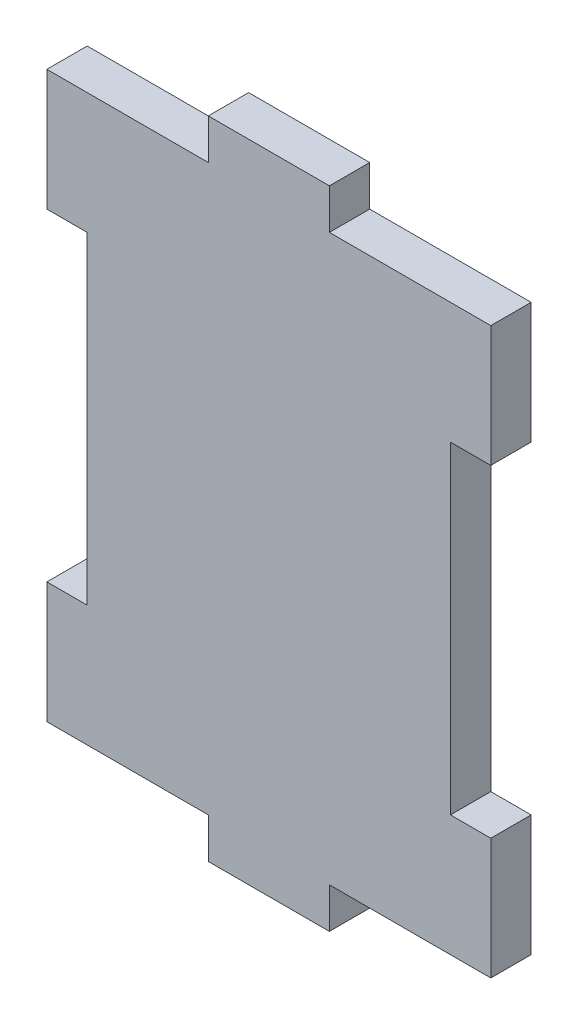
from build123d import *

# Parameters (mm, degrees)
BOSS_EXTRUDE2_DEPTH = 5
SKETCH3_W           = 5
SKETCH3_H           = 40
CUT_EXTRUDE1_DEPTH  = 5


with BuildPart() as part:
    # Sketch2 → Boss-Extrude2 (new body)
    with BuildSketch(Plane.XY):
        Polygon((-7.5, 40), (7.5, 40), (7.5, 35), (27.5, 35), (27.5, -35), (7.5, -35), (7.5, -40), (-7.5, -40), (-7.5, -35), (-27.5, -35), (-27.5, 35), (-7.5, 35), align=None)
    extrude(amount=BOSS_EXTRUDE2_DEPTH)

    # Sketch3 → Cut-Extrude1 (cut)
    with BuildSketch(Plane.XY.offset(5)):
        with Locations((-25, 0)):
            Rectangle(SKETCH3_W, SKETCH3_H)
    cut_extrude1 = extrude(amount=-CUT_EXTRUDE1_DEPTH, mode=Mode.SUBTRACT)

    # Mirror1: Cut-Extrude1 across plane
    add(cut_extrude1.mirror(Plane(origin=(0, 0, 0), x_dir=(0, 0, 1), z_dir=(1, 0, 0))), mode=Mode.SUBTRACT)


solid = part.part
